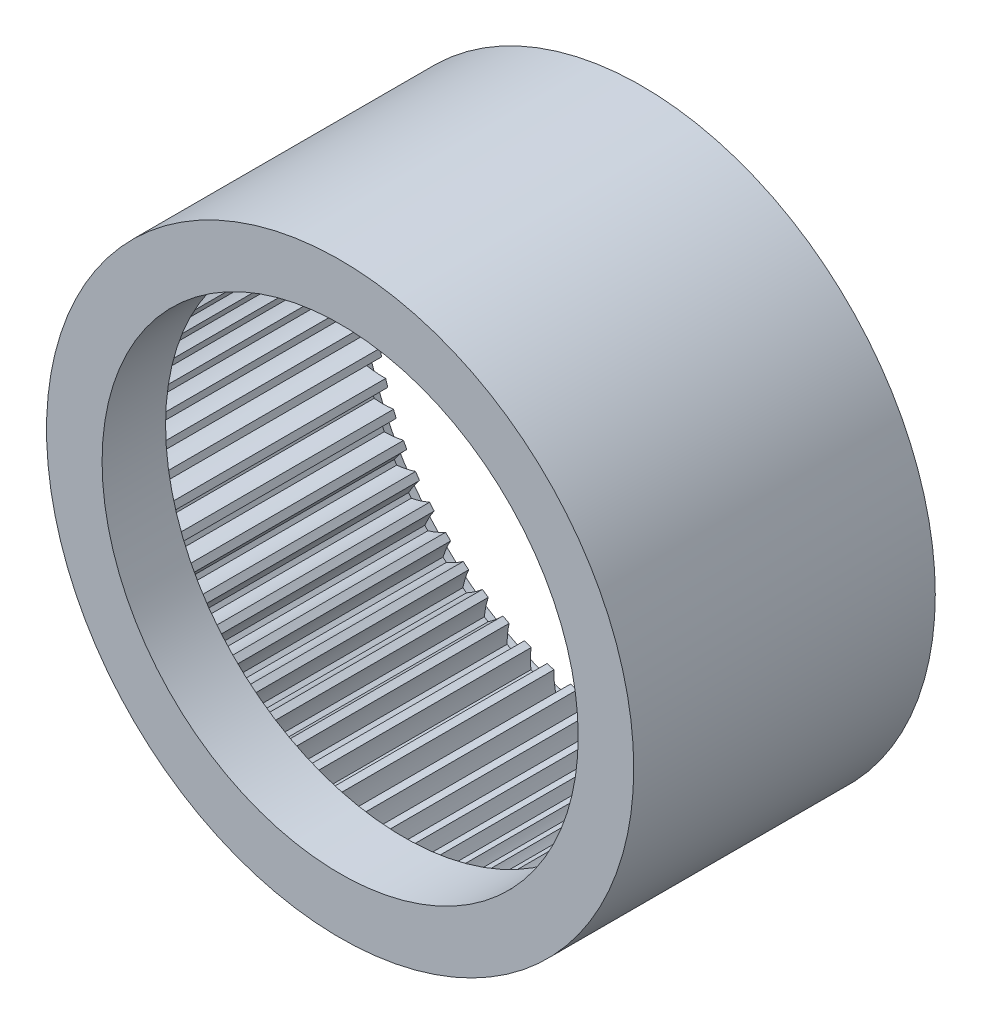
from build123d import *

# Parameters (mm, degrees)
SKETCH_1_R               = 35.500000005
SKETCH_1_R_2             = 33.25
EXTRUDE_1_DEPTH          = 30
EXTRUDE_2_DEPTH          = 30
PATTERN_CIRCULAR_1_COUNT = 64
SKETCH_4_R               = 37
EXTRUDE_3_DEPTH          = 8
EXTRUDE_START            = 30
SKETCH_5_R               = 37
SKETCH_5_R_2             = 35.500000005
EXTRUDE_4_DEPTH          = 30
SKETCH_6_R               = 35.5
CUT_EXTRUDE_1_DEPTH      = 2.5
CUT_EXTRUDE_2_DEPTH      = 61.3158354
CUT_EXTRUDE_2_DEPTH_BACK = 61.3158354
SKETCH_7_R               = 30


with BuildPart() as part:
    # 草图1 → 凸台-拉伸1 (new body)
    with BuildSketch(Plane.XY):
        Circle(SKETCH_1_R)
        Circle(SKETCH_1_R_2, mode=Mode.SUBTRACT)
    extrude(amount=EXTRUDE_1_DEPTH)

    # 草图2 → 凸台-拉伸2 (add)
    with BuildSketch(Plane.XY):
        with BuildLine():
            ThreePointArc((0.445946929, 30.960177178), (0, 30.963388696), (-0.445946929, 30.960177178))
            add(Edge.make_bspline(
                [(-0.445946929, 30.960177178), (-0.472827704, 31.06319537), (-0.518094241, 31.222637599), (-0.586968594, 31.441014308), (-0.647656558, 31.620827774), (-0.715998326, 31.810710742), (-0.792419587, 32.010424466), (-0.877339077, 32.219717246), (-0.971168712, 32.438324599), (-1.074313136, 32.665969437), (-1.187169268, 32.902362252), (-1.354711233, 33.235980531), (-1.490853689, 33.48755937), (-1.586763553, 33.656963253)],
                knots=[0, 0, 0, 0, 0.108783293, 0.169319875, 0.233953081, 0.30268291, 0.375509363, 0.45243244, 0.533452141, 0.618568465, 0.707781413, 0.801090985, 1, 1, 1, 1], degree=3))
            ThreePointArc((-1.586763553, 33.656963253), (0, 33.694346618), (1.586763553, 33.656963253))
            add(Edge.make_bspline(
                [(0.445946929, 30.960177178), (0.472827704, 31.06319537), (0.518094241, 31.222637599), (0.586968594, 31.441014308), (0.647656558, 31.620827774), (0.715998326, 31.810710742), (0.792419587, 32.010424466), (0.877339077, 32.219717246), (0.971168712, 32.438324599), (1.074313136, 32.665969437), (1.187169268, 32.902362252), (1.354711233, 33.235980531), (1.490853689, 33.48755937), (1.586763553, 33.656963253)],
                knots=[0, 0, 0, 0, 0.108783293, 0.169319875, 0.233953081, 0.30268291, 0.375509363, 0.45243244, 0.533452141, 0.618568465, 0.707781413, 0.801090985, 1, 1, 1, 1], degree=3))
        make_face()
    extrude_2 = extrude(amount=EXTRUDE_2_DEPTH)

    # 阵列(圆周)1: 凸台-拉伸2 ×64 about axis
    pattern_circular_1_axis = Axis((0, 0, 30), (0, 0, -1))
    for i in range(1, PATTERN_CIRCULAR_1_COUNT):
        add(extrude_2.rotate(pattern_circular_1_axis, i * 360 / PATTERN_CIRCULAR_1_COUNT))

    # 草图4 → 凸台-拉伸3 (add)
    with BuildSketch(Plane.XY.offset(30)):
        Circle(SKETCH_4_R)
    extrude(amount=EXTRUDE_3_DEPTH)

    # 草图5 → 凸台-拉伸4 (add)
    with BuildSketch(Plane(origin=(0, 0, 30), x_dir=(-1, 0, 0), z_dir=(0, 0, -1)).offset(EXTRUDE_START)):
        with Locations(Location((0, 0, 0), (0, 0, 180))):
            Circle(SKETCH_5_R)
        Circle(SKETCH_5_R_2, mode=Mode.SUBTRACT)
    extrude(amount=-EXTRUDE_4_DEPTH)

    # 草图6 → 切除-拉伸1 (cut)
    with BuildSketch(Plane(origin=(0, 0, 0), x_dir=(-1, 0, 0), z_dir=(0, 0, -1))):
        Circle(SKETCH_6_R)
    extrude(amount=-CUT_EXTRUDE_1_DEPTH, mode=Mode.SUBTRACT)

    # 草图7 → 切除-拉伸2 (cut, two sides: drawn at the far end of the back side and taken through both)
    with BuildSketch(Plane(origin=(0, 0, 30), x_dir=(-1, 0, 0), z_dir=(0, 0, -1)).offset(-CUT_EXTRUDE_2_DEPTH_BACK)):
        Circle(SKETCH_7_R)
    extrude(amount=CUT_EXTRUDE_2_DEPTH + CUT_EXTRUDE_2_DEPTH_BACK, mode=Mode.SUBTRACT)


solid = part.part
